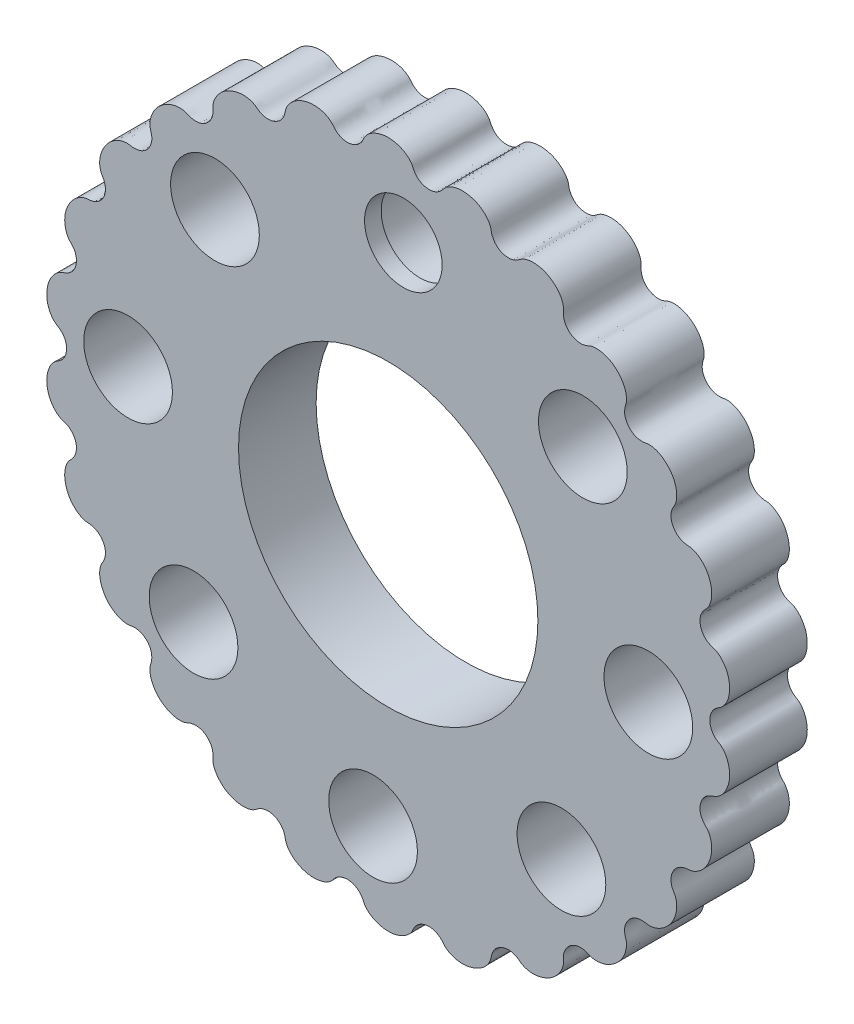
from build123d import *

# Parameters (mm, degrees)
SKETCH1_R        = 4
SKETCH1_R_2      = 13.5
EXTRUSION1_DEPTH = 7
EXTRUSION2_START = -1.5
SKETCH2_R        = 4
SKETCH2_R_2      = 3.5
EXTRUSION2_DEPTH = 1.5


with BuildPart() as part:
    # Sketch1 → Extrusion1 (new body)
    with BuildSketch(Plane.XY):
        with BuildLine():
            add(Edge.make_bspline(
                [(29, 0), (29, -0.376789204), (29.153513259, -0.703229563), (29.280402525, -0.883905996), (29.495133495, -1.189659407), (29.623510818, -1.242583836), (29.700019426, -1.295833756), (29.854226598, -1.403161804), (29.88265414, -1.412994243), (29.934648255, -1.448461782), (30.057359745, -1.532168844), (30.226573766, -1.667269836), (30.408052145, -1.955494437), (30.663331992, -2.360930792), (30.861446732, -3.06680081), (30.770659289, -3.762971134), (30.689739184, -4.383477382), (30.390255046, -4.954513185), (30.079404167, -5.289719413), (29.850529622, -5.536526414), (29.636586178, -5.660425735), (29.495438805, -5.723227119), (29.422146843, -5.755837266), (29.378667255, -5.76961159), (29.272559274, -5.805016474), (29.218748124, -5.822971556), (29.153849, -5.834396348), (28.970346246, -5.927674104), (28.848691254, -5.989513529), (28.638295722, -6.083579397), (28.402421601, -6.410574806), (28.230156467, -6.649388237), (28.101415723, -7.043920043), (28.114039967, -7.36632783), (28.13003751, -7.774885561), (28.272102362, -8.005844612), (28.356127129, -8.139006604), (28.505739094, -8.37611083), (28.568168114, -8.412323093), (28.612595809, -8.458659561), (28.711235488, -8.561537154), (28.744398474, -8.593760135), (28.808819097, -8.681895487), (28.948574282, -8.873097803), (29.151409878, -9.278419137), (29.175326567, -9.843287507), (29.201561715, -10.46291363), (28.968447422, -11.222843927), (28.567285081, -11.744523122), (28.224165345, -12.1907226), (27.796219964, -12.449058071), (27.512031378, -12.550259379), (27.358832379, -12.604814488), (27.25436537, -12.621049722), (27.158265381, -12.631046232), (27.099367254, -12.637172931), (27.067709293, -12.631488341), (26.873148531, -12.658460721), (26.788179826, -12.670240117), (26.665632167, -12.675675152), (26.416933975, -12.786433586), (26.232928362, -12.868380998), (25.946653249, -13.043759284), (25.740420799, -13.36934038), (25.544926925, -13.677968382), (25.489822974, -14.056912498), (25.506535744, -14.297475966), (25.533815346, -14.690138321), (25.631337693, -14.820256217), (25.67726007, -14.913047886), (25.767155033, -15.094691436), (25.790803082, -15.117574356), (25.819020041, -15.168683178), (25.885780874, -15.289605762), (25.95872212, -15.440829308), (26.000279455, -15.72147703), (26.063492675, -16.148372702), (25.978321637, -16.838256473), (25.624035928, -17.435865816), (25.273534038, -18.02709261), (24.684736969, -18.474969864), (24.204873828, -18.651888643), (23.850532913, -18.782529145), (23.58391245, -18.786530914), (23.423692808, -18.772306679), (23.353178507, -18.766046447), (23.313475257, -18.757998242), (23.193003065, -18.739109801), (23.130493718, -18.729309164), (23.057050179, -18.70439141), (22.817016308, -18.712748042), (22.665973243, -18.718006514), (22.411735467, -18.728224886), (22.074129263, -18.927651904), (21.803689676, -19.087402998), (21.537010762, -19.406590813), (21.426735852, -19.688830845), (21.270305731, -20.08920154), (21.316386948, -20.33233582), (21.33515342, -20.472892432), (21.369718287, -20.731775427), (21.400821881, -20.775045), (21.417284821, -20.831424873), (21.455421255, -20.96202896), (21.476017723, -21.033714564), (21.487059708, -21.194003219), (21.507665593, -21.493124234), (21.431991893, -22.035100014), (21.10046464, -22.56382238), (20.752479983, -23.118791147), (20.128266089, -23.598189384), (19.544493143, -23.790530755), (19.083278307, -23.942491709), (18.676784908, -23.930558237), (18.43738774, -23.882676974), (18.318275954, -23.858853706), (18.241679923, -23.831464215), (18.164838876, -23.800204857), (18.115287483, -23.78004708), (18.082088593, -23.759876823), (17.930173703, -23.703609039), (17.850190596, -23.673984081), (17.742072817, -23.617835381), (17.451890523, -23.598582777), (17.253236248, -23.585402744), (16.923751511, -23.605534598), (16.591139818, -23.793192282), (16.282780206, -23.967167077), (16.05488253, -24.265673436), (15.953178452, -24.485269327), (15.786354747, -24.84546924), (15.809506746, -25.014628377), (15.806088543, -25.121749654), (15.799481943, -25.328790473), (15.81061611, -25.361861802), (15.812109447, -25.418971328), (15.815641201, -25.554035759), (15.812406055, -25.704405001), (15.732664746, -25.953731572), (15.607596852, -26.344780447), (15.243418072, -26.912408891), (14.671037963, -27.292431394), (14.124718948, -27.655151056), (13.42767167, -27.814510539), (12.907715387, -27.778307624), (12.495865692, -27.74963183), (12.212478405, -27.625271416), (12.057583055, -27.532907426), (11.988100522, -27.49147504), (11.948201973, -27.461630149), (11.870914875, -27.403273336), (11.823322443, -27.367337937), (11.788753906, -27.319248435), (11.557639229, -27.198239248), (11.43929978, -27.13627797), (11.250146468, -27.031373812), (10.886678744, -27.017194857), (10.598987922, -27.005971975), (10.201432566, -27.111664102), (9.935629849, -27.301878904), (9.626564783, -27.523053281), (9.501689158, -27.761846503), (9.432870859, -27.908688978), (9.30095485, -28.190167505), (9.309619898, -28.270298288), (9.295631034, -28.337455332), (9.264435305, -28.487218252), (9.258552966, -28.527575136), (9.224995758, -28.627127141), (9.152563358, -28.842007673), (8.951268439, -29.22455999), (8.521291306, -29.564825082), (8.051312694, -29.936745595), (7.321670629, -30.195315854), (6.666548374, -30.18551273), (6.149536286, -30.17777626), (5.701998643, -30.01979544), (5.427983165, -29.85547943), (5.231722981, -29.737790128), (5.125408156, -29.631831284), (5.048933185, -29.544996261), (5.010375025, -29.501214633), (4.989516803, -29.470409418), (4.8984967, -29.364093053), (4.848368887, -29.305541078), (4.796999006, -29.214894746), (4.548899507, -29.046357174), (4.399181678, -28.944651691), (4.136411234, -28.798161464), (3.755673, -28.779285334), (3.414405592, -28.762366078), (3.042716869, -28.891985111), (2.824551091, -29.038709227), (2.484387171, -29.26748136), (2.405597414, -29.447359704), (2.344575844, -29.549095179), (2.22972714, -29.740571529), (2.224096245, -29.781013939), (2.199893849, -29.831433208), (2.143040371, -29.949872339), (2.090804872, -30.050667939), (1.948163151, -30.209644586), (1.704155366, -30.48159545), (1.181104411, -30.83769535), (0.518371049, -30.95472865), (-0.143255115, -31.071566429), (-0.891215069, -30.925579479), (-1.383857125, -30.651354116), (-1.724356119, -30.461818004), (-1.942342037, -30.234234972), (-2.058694069, -30.072741656), (-2.132811533, -29.969868721), (-2.164149671, -29.907017862), (-2.210380122, -29.809426793), (-2.229700089, -29.768642932), (-2.247192336, -29.723553138), (-2.308596707, -29.611786605), (-2.353963805, -29.529210671), (-2.403608644, -29.398358825), (-2.648504122, -29.176526635), (-2.811364542, -29.029003764), (-3.114843055, -28.83641096), (-3.489126798, -28.789352791), (-3.851241679, -28.743824595), (-4.188506196, -28.847742856), (-4.384723272, -28.948769214), (-4.717099561, -29.119899915), (-4.791674777, -29.244772824), (-4.856233022, -29.316051809), (-4.983929976, -29.457042464), (-4.997746831, -29.485760536), (-5.036905099, -29.53118873), (-5.133461533, -29.643205544), (-5.275985883, -29.78775877), (-5.572511333, -29.934209596), (-5.981254164, -30.136083415), (-6.669097215, -30.263104747), (-7.337150557, -30.118112097), (-8.005422406, -29.973072023), (-8.599322793, -29.565327432), (-8.90670342, -29.186424709), (-9.108385875, -28.937814273), (-9.197225057, -28.722791811), (-9.23961282, -28.581181709), (-9.25829201, -28.518777803), (-9.268174338, -28.472926288), (-9.283174683, -28.39863402), (-9.292241027, -28.3537311), (-9.298811144, -28.302862183), (-9.334414747, -28.175648604), (-9.36147998, -28.078943076), (-9.383274666, -27.927568033), (-9.586375382, -27.648595316), (-9.724085585, -27.459440937), (-10.002669302, -27.203566404), (-10.358057207, -27.08939079), (-10.712288342, -26.975586811), (-11.047428124, -27.018036104), (-11.247271358, -27.074370779), (-11.607160156, -27.175821391), (-11.690494591, -27.273289118), (-11.763091617, -27.324129438), (-11.91443087, -27.430113614), (-11.9326436, -27.451277308), (-11.990494242, -27.490297087), (-12.126510685, -27.582039053), (-12.364031199, -27.711242846), (-12.762304293, -27.763719538), (-13.262518248, -27.829628016), (-13.979986828, -27.712548347), (-14.561666645, -27.361677552), (-15.142387956, -27.01138493), (-15.544189918, -26.459983693), (-15.698654591, -26.05121109), (-15.795993367, -25.793615459), (-15.811648643, -25.609789997), (-15.812728579, -25.480621977), (-15.813143796, -25.430958983), (-15.811194859, -25.390583128), (-15.808098369, -25.314809119), (-15.80603082, -25.264214284), (-15.798697321, -25.203924251), (-15.809876958, -25.048307991), (-15.818162357, -24.932978399), (-15.817266226, -24.750262954), (-15.978009681, -24.434133715), (-16.092933598, -24.208116362), (-16.34396621, -23.916340633), (-16.652752822, -23.760262264), (-17.009927335, -23.57972589), (-17.333182061, -23.58392321), (-17.521203248, -23.604713619), (-17.853387005, -23.641444778), (-17.932654993, -23.703306136), (-18.00367317, -23.732275098), (-18.156071724, -23.794439858), (-18.183843461, -23.810305706), (-18.262019218, -23.836355439), (-18.440426314, -23.895804269), (-18.775676263, -23.962903754), (-19.236779227, -23.871624394), (-19.773156003, -23.765443924), (-20.426775322, -23.406126011), (-20.85810381, -22.895418828), (-21.286151212, -22.388596558), (-21.47085206, -21.779570597), (-21.488930141, -21.394614583), (-21.500621317, -21.145661823), (-21.468865946, -21.013759747), (-21.431565807, -20.881029713), (-21.419598524, -20.838444941), (-21.405336227, -20.798008705), (-21.378065716, -20.691137708), (-21.358368957, -20.613947657), (-21.314606088, -20.512619306), (-21.320946107, -20.221114476), (-21.325157041, -20.027501856), (-21.367726323, -19.699302641), (-21.596507682, -19.37075596), (-21.805015671, -19.071323315), (-22.144668616, -18.865630978), (-22.383630568, -18.788290041), (-22.775331784, -18.661514466), (-22.938900049, -18.709912643), (-23.044907923, -18.72000009), (-23.244105229, -18.738955212), (-23.275722221, -18.753159272), (-23.332294806, -18.761415327), (-23.470632783, -18.781604011), (-23.633917403, -18.796910673), (-23.910368317, -18.73778214), (-24.317955011, -18.650605712), (-24.911212213, -18.348260848), (-25.344006425, -17.831383438), (-25.776274137, -17.315134817), (-26.009005348, -16.620732001), (-26.022312378, -16.099736428), (-26.030488039, -15.779643688), (-25.971521912, -15.531144499), (-25.912768729, -15.372231853), (-25.879445986, -15.282102182), (-25.848804962, -15.221918981), (-25.813525479, -15.158792832), (-25.79076123, -15.118060394), (-25.767720937, -15.0833216), (-25.712862173, -14.981763959), (-25.678735759, -14.918587213), (-25.623775022, -14.838440372), (-25.560344984, -14.609836108), (-25.515341819, -14.447642989), (-25.45606319, -14.173517302), (-25.552037739, -13.803688322), (-25.638692263, -13.469773193), (-25.891757905, -13.130612652), (-26.118413124, -12.961295021), (-26.446587443, -12.716139852), (-26.652479534, -12.698358105), (-26.773903808, -12.674868854), (-26.998785053, -12.631366088), (-27.042788745, -12.641056046), (-27.098481374, -12.636501344), (-27.234209956, -12.625401073), (-27.335712061, -12.614944718), (-27.526823798, -12.544915294), (-27.851146092, -12.426073282), (-28.353695378, -12.095384857), (-28.706603378, -11.546591504), (-29.06035764, -10.99648216), (-29.221901536, -10.261461854), (-29.164411473, -9.690095777), (-29.116641163, -9.215329648), (-28.946347537, -8.875733747), (-28.821278154, -8.699208681), (-28.761199142, -8.614412136), (-28.719790087, -8.569916158), (-28.650828294, -8.498340774), (-28.617066481, -8.463299418), (-28.577830967, -8.430353535), (-28.479946744, -8.310527477), (-28.415974196, -8.232214772), (-28.307335635, -8.12424224), (-28.199217347, -7.814438004), (-28.123005002, -7.596057676), (-28.071043132, -7.229002615), (-28.174726822, -6.87560927), (-28.282711502, -6.50755652), (-28.517068857, -6.249167235), (-28.680068264, -6.116174749), (-28.96041353, -5.887438862), (-29.085822206, -5.872195266), (-29.168080895, -5.841573506), (-29.337012176, -5.778686858), (-29.366231414, -5.775040483), (-29.428891311, -5.75083548), (-29.575851639, -5.694065916), (-29.800298383, -5.583648839), (-30.060367543, -5.309997757), (-30.393485756, -4.959482689), (-30.716850495, -4.333209538), (-30.781775017, -3.665272415), (-30.845824216, -3.00634053), (-30.65602066, -2.355101486), (-30.415698666, -1.967728855), (-30.277120915, -1.744356755), (-30.13509608, -1.604275471), (-30.03007677, -1.519291986), (-29.957369662, -1.460456107), (-29.916605658, -1.435631903), (-29.813666622, -1.37061783), (-29.766710644, -1.340961449), (-29.708025916, -1.314263856), (-29.557868822, -1.186841016), (-29.455260582, -1.099767985), (-29.272385362, -0.963203143), (-29.116117525, -0.584778374), (-29.000884912, -0.305726228), (-28.969803973, 0.125948685), (-29.065388195, 0.442485153), (-29.184052374, 0.835453149), (-29.377333441, 1.019376249), (-29.489749135, 1.125797953), (-29.690366917, 1.315718822), (-29.757206414, 1.334920749), (-29.810603818, 1.368682388), (-29.929768192, 1.444026587), (-29.971689203, 1.468878417), (-30.058370404, 1.542800073), (-30.243927978, 1.701043417), (-30.54151476, 2.059991498), (-30.694284834, 2.614224595), (-30.861323307, 3.220221883), (-30.801284883, 4.017880871), (-30.526869714, 4.613201454), (-30.289365399, 5.128447049), (-29.928196364, 5.469300484), (-29.68153631, 5.623716451), (-29.575145044, 5.690320305), (-29.492430437, 5.726810499), (-29.419145192, 5.754562991), (-29.361545051, 5.776375669), (-29.327692281, 5.783104484), (-29.180206176, 5.837097496), (-29.109781404, 5.862879217), (-29.010074318, 5.88508112), (-28.793211902, 6.031980364), (-28.6485518, 6.129970877), (-28.42112486, 6.310060413), (-28.259066262, 6.65362343), (-28.115026168, 6.958987354), (-28.09008166, 7.358682651), (-28.14604737, 7.623810648), (-28.233016296, 8.035811085), (-28.378672015, 8.181444066), (-28.45394424, 8.277958096), (-28.596223142, 8.460388073), (-28.632573095, 8.479048758), (-28.671514566, 8.519909872), (-28.762970552, 8.615874231), (-28.838162873, 8.699534929), (-28.936455769, 8.889221435), (-29.106812244, 9.217976878), (-29.255848082, 9.847598949), (-29.121664872, 10.519348259), (-28.987564861, 11.190681059), (-28.56740915, 11.841350341), (-28.129487583, 12.195502904), (-27.780573832, 12.47767375), (-27.461018124, 12.580313829), (-27.27527929, 12.614447663), (-27.199624067, 12.628351071), (-27.150829028, 12.632435802), (-27.058014802, 12.639711166), (-27.00151509, 12.644139969), (-26.943305829, 12.636091875), (-26.723316859, 12.685427116), (-26.6026533, 12.712487408), (-26.409624397, 12.747329453), (-26.128422509, 12.953880477), (-25.910944679, 13.113624314), (-25.662798484, 13.427513535), (-25.566322816, 13.752334315), (-25.452954535, 14.134030287), (-25.511376242, 14.428267343), (-25.557174596, 14.598242149), (-25.63761469, 14.896785406), (-25.701254959, 14.96199933), (-25.736666763, 15.024871352), (-25.812643968, 15.159765371), (-25.832711467, 15.188601008), (-25.86858561, 15.265908818), (-25.95180307, 15.4452402), (-26.061021603, 15.796670594), (-26.009969417, 16.290275064), (-25.951468756, 16.855896049), (-25.638772006, 17.555314201), (-25.162283149, 18.029466008), (-24.748728938, 18.440991847), (-24.24642911, 18.669333848), (-23.89197135, 18.741625677), (-23.653710104, 18.790219172), (-23.49403235, 18.781678219), (-23.375015124, 18.767162962), (-23.315572934, 18.759913435), (-23.280311537, 18.750630578), (-23.137565616, 18.73089565), (-23.061042331, 18.720316143), (-22.962061884, 18.686556057), (-22.664548487, 18.725245809), (-22.484723827, 18.748630879), (-22.190520146, 18.8138919), (-21.893470913, 19.052646676), (-21.626951442, 19.266863007), (-21.435540536, 19.610440168), (-21.36995716, 19.864601166), (-21.267593511, 20.261299971), (-21.327982031, 20.447618467), (-21.349786939, 20.563994202), (-21.390832203, 20.783058317), (-21.413355093, 20.816991437), (-21.428664725, 20.870774772), (-21.464631811, 20.997128553), (-21.492452324, 21.107715369), (-21.490910217, 21.321951179), (-21.488278104, 21.687615204), (-21.332419784, 22.300574747), (-20.914098226, 22.82707231), (-20.496872099, 23.352191169), (-19.841777334, 23.738304129), (-19.291903219, 23.860064829), (-18.924188821, 23.941489216), (-18.617245176, 23.920560063), (-18.422408764, 23.879604969), (-18.31563017, 23.857159846), (-18.243553296, 23.831836435), (-18.173556833, 23.803728826), (-18.130392891, 23.786396018), (-18.093787939, 23.768849924), (-17.999094408, 23.73041191), (-17.92817914, 23.701625972), (-17.846767922, 23.641691775), (-17.525942455, 23.605244833), (-17.345331763, 23.584726801), (-17.042466604, 23.57739302), (-16.695375411, 23.739540695), (-16.385650533, 23.884232262), (-16.118572277, 24.171891566), (-15.994502316, 24.402601032), (-15.801287793, 24.761885575), (-15.814885759, 24.956858471), (-15.808159699, 25.074992256), (-15.795544122, 25.296567105), (-15.809226093, 25.335448685), (-15.811235377, 25.391185584), (-15.81594861, 25.521929151), (-15.81661578, 25.633771899), (-15.76557369, 25.838231515), (-15.678418206, 26.187350782), (-15.38935816, 26.738476294), (-14.866909812, 27.150554528), (-14.345665583, 27.56168302), (-13.625065441, 27.789169095), (-13.059243608, 27.784206894), (-12.699360044, 27.781050751), (-12.40959978, 27.699749511), (-12.22295316, 27.617771279), (-12.088985747, 27.558930611), (-12.012415962, 27.507785565), (-11.935379801, 27.451475288), (-11.89957228, 27.425301457), (-11.867671351, 27.398850043), (-11.78411078, 27.339017082), (-11.72485787, 27.296589452), (-11.65447184, 27.228848894), (-11.411755341, 27.130671047), (-11.251421739, 27.06581675), (-10.97525545, 26.974485588), (-10.591009136, 27.034225453), (-10.245095457, 27.088005634), (-9.886721339, 27.30723371), (-9.699148999, 27.510999828), (-9.422955251, 27.81103835), (-9.386355398, 28.006730408), (-9.350491864, 28.121355102), (-9.283595069, 28.335166289), (-9.287629251, 28.377653166), (-9.276328264, 28.432202636), (-9.248619946, 28.565949724), (-9.222912155, 28.675415127), (-9.119915077, 28.867977144), (-8.949932482, 29.185774426), (-8.538283511, 29.646741189), (-7.937079008, 29.919616823), (-7.336306535, 30.192296368), (-6.58767896, 30.242266848), (-6.040570614, 30.10466661), (-5.614070166, 29.997399807), (-5.322579412, 29.803931331), (-5.168650159, 29.66592866), (-5.09200491, 29.597213657), (-5.050374214, 29.548840834), (-4.992991306, 29.478663173), (-4.962876994, 29.441834229), (-4.936434411, 29.401984589), (-4.837846061, 29.296019422), (-4.775916492, 29.229456008), (-4.695712644, 29.124026378), (-4.441848526, 28.979698039), (-4.260308077, 28.876487582), (-3.941762372, 28.754072863), (-3.56794143, 28.78151104), (-3.197466652, 28.808703611), (-2.868927436, 28.989558501), (-2.690954424, 29.139445162), (-2.393105298, 29.390289998), (-2.349772761, 29.535692131), (-2.302761238, 29.622483952), (-2.20886408, 29.795835184), (-2.203550235, 29.82579248), (-2.175867732, 29.88018106), (-2.11046229, 30.008684946), (-2.009773476, 30.177613031), (-1.768150686, 30.385191874), (-1.415577805, 30.688088264), (-0.752418447, 30.988774256), (-0.046167636, 30.999644728), (0.592266715, 31.009471383), (1.219510345, 30.785204282), (1.605011517, 30.51235251), (1.891097503, 30.309865272), (2.045930615, 30.104725908), (2.127116658, 29.968736277), (2.167438181, 29.901196229), (2.186602044, 29.859458673), (2.233005038, 29.76152411), (2.257355256, 29.710132427), (2.275725221, 29.64749951), (2.392614611, 29.47339957), (2.467027217, 29.362566327), (2.581908309, 29.173501841), (2.917495722, 28.980878823), (3.168004516, 28.837089878), (3.570530407, 28.746735558), (3.894196472, 28.792482835), (4.296685945, 28.849371089), (4.518598116, 29.016680122), (4.645208022, 29.117156834), (4.869888815, 29.295461895), (4.900400795, 29.365411925), (4.942187589, 29.416317379), (5.034218341, 29.528430961), (5.059850792, 29.562818103), (5.133890892, 29.633725391), (5.297447577, 29.790361604), (5.653420861, 30.036407331), (6.193533924, 30.138262765), (6.787121194, 30.250202456), (7.56080253, 30.136873657), (8.138149347, 29.818829343), (8.581443665, 29.574630824), (8.897838497, 29.23499257), (9.063487098, 28.966067258), (9.18165652, 28.774222905), (9.228771833, 28.629915123), (9.256579828, 28.51949661), (9.272107014, 28.457842082), (9.275055696, 28.42350385), (9.309657797, 28.273192334), (9.327096963, 28.197436599), (9.331152725, 28.091834709), (9.473647564, 27.82769558), (9.560207198, 27.667242144), (9.727681559, 27.414950204), (10.056909547, 27.223458982), (10.353094853, 27.051186612), (10.741565015, 26.996366299), (11.001162027, 27.025939364), (11.407533903, 27.072232894), (11.558749341, 27.1944073), (11.659183654, 27.255867397), (11.848352182, 27.371627795), (11.871971738, 27.404431533), (11.916832906, 27.437793645), (12.022261653, 27.516198328), (12.117104247, 27.582173773), (12.319996567, 27.656847025), (12.664297564, 27.783564857), (13.292839116, 27.853335393), (13.932250402, 27.648073894), (14.568901864, 27.443698344), (15.159421893, 26.969881), (15.467654163, 26.500496006), (15.659825574, 26.207851836), (15.751543918, 25.931415117), (15.787604242, 25.737120609), (15.813498746, 25.597599956), (15.814641251, 25.508390037), (15.811972558, 25.413941053), (15.810730864, 25.369995665), (15.807069113, 25.328551417), (15.805393111, 25.226148408), (15.804179271, 25.151983315), (15.7873494, 25.05356127), (15.848551533, 24.790228208), (15.888635603, 24.617759368), (15.977450228, 24.332208035), (16.252246132, 24.052811244), (16.500029195, 23.800879567), (16.883970695, 23.641332385), (17.153354448, 23.60733672), (17.555385218, 23.55660128), (17.730538136, 23.637926529), (17.842431172, 23.673409624), (18.05215936, 23.739917832), (18.083766447, 23.766279926), (18.135066232, 23.787868373), (18.260697305, 23.840737595), (18.372012121, 23.883670807), (18.597896167, 23.906652225), (18.963986255, 23.94389819), (19.58182752, 23.857177181), (20.144851752, 23.50995364), (20.726503476, 23.15124231), (21.191774557, 22.530343728), (21.37240243, 21.993317545), (21.51231617, 21.577338879), (21.502051841, 21.242345513), (21.470701674, 21.052896276), (21.455936181, 20.963668318), (21.441653252, 20.91493797), (21.411311027, 20.810976441), (21.396040953, 20.758656602), (21.370577153, 20.704114298), (21.340293152, 20.508535286), (21.321717047, 20.388567782), (21.28105173, 20.199338227), (21.37268296, 19.854187676), (21.443156605, 19.58873214), (21.654701782, 19.230742735), (21.933743468, 19.021367021), (22.254107694, 18.780985416), (22.548706875, 18.734993043), (22.722364767, 18.718793861), (23.027794823, 18.690302688), (23.109111501, 18.726245696), (23.179524642, 18.737021226), (23.331364546, 18.760257733), (23.366301479, 18.768774906), (23.453813913, 18.774656509), (23.655700667, 18.788225069), (24.034486714, 18.761478442), (24.484384746, 18.528096714), (24.987179246, 18.267275281), (25.516427984, 17.72992395), (25.784568682, 17.124692357), (26.034421704, 16.560738643), (26.054389766, 15.98118336), (25.983955408, 15.627199703), (25.93824624, 15.397478032), (25.876945456, 15.272978571), (25.816485337, 15.164105626), (25.795349021, 15.12604462), (25.773814482, 15.091757373), (25.728534405, 15.01034342), (25.695222559, 14.950448444), (25.640906458, 14.879361146), (25.569802117, 14.642575819), (25.523697247, 14.4890415), (25.457187963, 14.231317448), (25.538420004, 13.860612761), (25.610866156, 13.530002724), (25.852159498, 13.171636715), (26.083072201, 12.988500473), (26.407274822, 12.731376248), (26.624500014, 12.705657793), (26.751105714, 12.679434353), (26.983700433, 12.631257741), (27.030982702, 12.64190545), (27.087317817, 12.637403241), (27.217776505, 12.6269772), (27.302684737, 12.618898166), (27.467056974, 12.565565056), (27.768649791, 12.467708611), (28.260881462, 12.178795965), (28.630768295, 11.658690446), (29.001460154, 11.137452963), (29.203853989, 10.413047322), (29.174387587, 9.822933994), (29.150775545, 9.350063893), (29.000317503, 8.982726488), (28.872952639, 8.77720065), (28.80852858, 8.673240983), (28.755018636, 8.609811649), (28.699503989, 8.54969935), (28.669134773, 8.516814995), (28.640063318, 8.48874736), (28.575255084, 8.419221478), (28.527612321, 8.36811061), (28.45538984, 8.313194125), (28.323398012, 8.084843835), (28.24092458, 7.94216203), (28.114652627, 7.697481464), (28.112882147, 7.313407763), (28.111301224, 6.9704548), (28.269825348, 6.57261128), (28.4502273, 6.347759547), (28.707970046, 6.026510785), (28.907371612, 5.956119728), (29.021366479, 5.902786247), (29.23175097, 5.804356048), (29.278019071, 5.803312496), (29.331212991, 5.785537568), (29.460376133, 5.742377268), (29.552018589, 5.709870289), (29.716067657, 5.601503494), (29.996607113, 5.416186004), (30.402321802, 4.990358438), (30.620458512, 4.384591576), (30.843511302, 3.765172736), (30.834342658, 3.000421818), (30.642754999, 2.448412257), (30.486542596, 1.998327215), (30.241623115, 1.704057531), (30.076359327, 1.55839712), (29.993727432, 1.485566915), (29.940583244, 1.450626754), (29.855027721, 1.396665019), (29.81224996, 1.369684152), (29.765950817, 1.348657309), (29.629385223, 1.244386394), (29.550532024, 1.184180197), (29.426925187, 1.103473897), (29.260661084, 0.855118407), (29.138972937, 0.673347843), (29, 0.357362991), (29, 0)],
                knots=[0, 0, 0, 0, 0.27327128, 0.27327128, 0.27327128, 0.735720224, 0.735720224, 0.735720224, 1.667810689, 1.667810689, 1.667810689, 3.867640605, 3.867640605, 3.867640605, 6.962071187, 6.962071187, 6.962071187, 9.720180006, 9.720180006, 9.720180006, 11.750931547, 11.750931547, 11.750931547, 12.805416376, 12.805416376, 12.805416376, 13.340183332, 13.340183332, 13.340183332, 13.694712449, 13.694712449, 13.694712449, 13.953634478, 13.953634478, 13.953634478, 14.281742547, 14.281742547, 14.281742547, 14.865961877, 14.865961877, 14.865961877, 16.163062891, 16.163062891, 16.163062891, 18.977015681, 18.977015681, 18.977015681, 22.063750132, 22.063750132, 22.063750132, 24.703877084, 24.703877084, 24.703877084, 26.12710387, 26.12710387, 26.12710387, 26.999376521, 26.999376521, 26.999376521, 27.380316011, 27.380316011, 27.380316011, 27.662163673, 27.662163673, 27.662163673, 27.929335455, 27.929335455, 27.929335455, 28.365429521, 28.365429521, 28.365429521, 29.219101794, 29.219101794, 29.219101794, 31.238875534, 31.238875534, 31.238875534, 34.311170798, 34.311170798, 34.311170798, 37.35065353, 37.35065353, 37.35065353, 39.595070736, 39.595070736, 39.595070736, 40.582861675, 40.582861675, 40.582861675, 41.095396274, 41.095396274, 41.095396274, 41.417912412, 41.417912412, 41.417912412, 41.676264095, 41.676264095, 41.676264095, 42.04274805, 42.04274805, 42.04274805, 42.717753387, 42.717753387, 42.717753387, 44.281404563, 44.281404563, 44.281404563, 47.199396046, 47.199396046, 47.199396046, 50.262240061, 50.262240061, 50.262240061, 52.68206631, 52.68206631, 52.68206631, 53.886048084, 53.886048084, 53.886048084, 54.662442685, 54.662442685, 54.662442685, 55.071214023, 55.071214023, 55.071214023, 55.351052508, 55.351052508, 55.351052508, 55.610486823, 55.610486823, 55.610486823, 56.036033118, 56.036033118, 56.036033118, 56.858516347, 56.858516347, 56.858516347, 58.803694964, 58.803694964, 58.803694964, 61.85455274, 61.85455274, 61.85455274, 64.766501617, 64.766501617, 64.766501617, 67.073013323, 67.073013323, 67.073013323, 68.10766204, 68.10766204, 68.10766204, 68.74478582, 68.74478582, 68.74478582, 69.071017274, 69.071017274, 69.071017274, 69.329234961, 69.329234961, 69.329234961, 69.629480451, 69.629480451, 69.629480451, 70.205013232, 70.205013232, 70.205013232, 71.488474566, 71.488474566, 71.488474566, 74.258794008, 74.258794008, 74.258794008, 77.286840815, 77.286840815, 77.286840815, 79.676527305, 79.676527305, 79.676527305, 81.388110577, 81.388110577, 81.388110577, 82.251079216, 82.251079216, 82.251079216, 82.726344882, 82.726344882, 82.726344882, 83.013148135, 83.013148135, 83.013148135, 83.270218726, 83.270218726, 83.270218726, 83.671043002, 83.671043002, 83.671043002, 84.425434422, 84.425434422, 84.425434422, 86.19756373, 86.19756373, 86.19756373, 89.229028452, 89.229028452, 89.229028452, 92.255428643, 92.255428643, 92.255428643, 94.347183107, 94.347183107, 94.347183107, 95.679652626, 95.679652626, 95.679652626, 96.236499184, 96.236499184, 96.236499184, 96.64791147, 96.64791147, 96.64791147, 96.921508918, 96.921508918, 96.921508918, 97.186211056, 97.186211056, 97.186211056, 97.634595652, 97.634595652, 97.634595652, 98.521505556, 98.521505556, 98.521505556, 100.708447476, 100.708447476, 100.708447476, 103.723017825, 103.723017825, 103.723017825, 106.738574179, 106.738574179, 106.738574179, 108.717179068, 108.717179068, 108.717179068, 109.589099009, 109.589099009, 109.589099009, 110.116095319, 110.116095319, 110.116095319, 110.516708658, 110.516708658, 110.516708658, 110.788340121, 110.788340121, 110.788340121, 111.059087437, 111.059087437, 111.059087437, 111.546664248, 111.546664248, 111.546664248, 112.563090307, 112.563090307, 112.563090307, 114.952876385, 114.952876385, 114.952876385, 117.954345382, 117.954345382, 117.954345382, 120.950868485, 120.950868485, 120.950868485, 122.839183047, 122.839183047, 122.839183047, 123.565209152, 123.565209152, 123.565209152, 124.049981858, 124.049981858, 124.049981858, 124.409254331, 124.409254331, 124.409254331, 124.666117043, 124.666117043, 124.666117043, 124.963231006, 124.963231006, 124.963231006, 125.488152872, 125.488152872, 125.488152872, 126.614587499, 126.614587499, 126.614587499, 129.185255662, 129.185255662, 129.185255662, 132.175578446, 132.175578446, 132.175578446, 135.143154053, 135.143154053, 135.143154053, 137.062298345, 137.062298345, 137.062298345, 137.678031794, 137.678031794, 137.678031794, 138.122759535, 138.122759535, 138.122759535, 138.418140242, 138.418140242, 138.418140242, 138.687345904, 138.687345904, 138.687345904, 139.12862195, 139.12862195, 139.12862195, 139.957815067, 139.957815067, 139.957815067, 141.985456179, 141.985456179, 141.985456179, 144.97491831, 144.97491831, 144.97491831, 147.960743717, 147.960743717, 147.960743717, 149.795195074, 149.795195074, 149.795195074, 150.835631452, 150.835631452, 150.835631452, 151.506977805, 151.506977805, 151.506977805, 151.924607413, 151.924607413, 151.924607413, 152.220912684, 152.220912684, 152.220912684, 152.488443942, 152.488443942, 152.488443942, 152.875802719, 152.875802719, 152.875802719, 153.593202304, 153.593202304, 153.593202304, 155.341577808, 155.341577808, 155.341577808, 158.308622964, 158.308622964, 158.308622964, 161.282783008, 161.282783008, 161.282783008, 163.754106576, 163.754106576, 163.754106576, 164.941245048, 164.941245048, 164.941245048, 165.522435667, 165.522435667, 165.522435667, 165.902274659, 165.902274659, 165.902274659, 166.170022335, 166.170022335, 166.170022335, 166.448876676, 166.448876676, 166.448876676, 166.928482682, 166.928482682, 166.928482682, 167.913429767, 167.913429767, 167.913429767, 170.223490153, 170.223490153, 170.223490153, 173.182407649, 173.182407649, 173.182407649, 176.10143253, 176.10143253, 176.10143253, 177.784640539, 177.784640539, 177.784640539, 178.949961331, 178.949961331, 178.949961331, 179.481526219, 179.481526219, 179.481526219, 179.844765382, 179.844765382, 179.844765382, 180.112619593, 180.112619593, 180.112619593, 180.445150417, 180.445150417, 180.445150417, 181.038587098, 181.038587098, 181.038587098, 182.362930697, 182.362930697, 182.362930697, 185.197939711, 185.197939711, 185.197939711, 188.297732526, 188.297732526, 188.297732526, 190.980580455, 190.980580455, 190.980580455, 192.137766567, 192.137766567, 192.137766567, 193.047282296, 193.047282296, 193.047282296, 193.481577022, 193.481577022, 193.481577022, 193.771277379, 193.771277379, 193.771277379, 194.02876737, 194.02876737, 194.02876737, 194.42889859, 194.42889859, 194.42889859, 195.185223125, 195.185223125, 195.185223125, 196.961488953, 196.961488953, 196.961488953, 200.040026649, 200.040026649, 200.040026649, 203.116655537, 203.116655537, 203.116655537, 205.567957794, 205.567957794, 205.567957794, 206.566423299, 206.566423299, 206.566423299, 207.17422897, 207.17422897, 207.17422897, 207.5076093, 207.5076093, 207.5076093, 207.76544125, 207.76544125, 207.76544125, 208.068418837, 208.068418837, 208.068418837, 208.600567795, 208.600567795, 208.600567795, 209.742311133, 209.742311133, 209.742311133, 212.390819859, 212.390819859, 212.390819859, 215.425743981, 215.425743981, 215.425743981, 218.059815336, 218.059815336, 218.059815336, 219.830399005, 219.830399005, 219.830399005, 220.714702676, 220.714702676, 220.714702676, 221.188760509, 221.188760509, 221.188760509, 221.475293113, 221.475293113, 221.475293113, 221.732376821, 221.732376821, 221.732376821, 222.133637444, 222.133637444, 222.133637444, 222.888965035, 222.888965035, 222.888965035, 224.663464485, 224.663464485, 224.663464485, 227.692232709, 227.692232709, 227.692232709, 230.713069703, 230.713069703, 230.713069703, 232.733177989, 232.733177989, 232.733177989, 233.840282767, 233.840282767, 233.840282767, 234.522988765, 234.522988765, 234.522988765, 235.034262116, 235.034262116, 235.034262116, 235.322086629, 235.322086629, 235.322086629, 235.578925218, 235.578925218, 235.578925218, 235.978900722, 235.978900722, 235.978900722, 236.729105356, 236.729105356, 236.729105356, 238.488880851, 238.488880851, 238.488880851, 241.493735993, 241.493735993, 241.493735993, 244.491665657, 244.491665657, 244.491665657, 246.398459547, 246.398459547, 246.398459547, 247.767079274, 247.767079274, 247.767079274, 248.403233513, 248.403233513, 248.403233513, 248.854331306, 248.854331306, 248.854331306, 249.152317367, 249.152317367, 249.152317367, 249.420576166, 249.420576166, 249.420576166, 249.815577919, 249.815577919, 249.815577919, 250.552380705, 250.552380705, 250.552380705, 252.358910223, 252.358910223, 252.358910223, 255.340340193, 255.340340193, 255.340340193, 258.319627693, 258.319627693, 258.319627693, 260.642142899, 260.642142899, 260.642142899, 261.798581669, 261.798581669, 261.798581669, 262.40547592, 262.40547592, 262.40547592, 262.78670453, 262.78670453, 262.78670453, 263.05932444, 263.05932444, 263.05932444, 263.32950406, 263.32950406, 263.32950406, 263.781666796, 263.781666796, 263.781666796, 264.684781469, 264.684781469, 264.684781469, 266.81857029, 266.81857029, 266.81857029, 269.932167619, 269.932167619, 269.932167619, 272.746787381, 272.746787381, 272.746787381, 274.835557339, 274.835557339, 274.835557339, 275.872957182, 275.872957182, 275.872957182, 276.417338274, 276.417338274, 276.417338274, 276.763895096, 276.763895096, 276.763895096, 277.022592317, 277.022592317, 277.022592317, 277.344290881, 277.344290881, 277.344290881, 277.915174236, 277.915174236, 277.915174236, 279.172481119, 279.172481119, 279.172481119, 281.949907732, 281.949907732, 281.949907732, 285.002315078, 285.002315078, 285.002315078, 287.345992732, 287.345992732, 287.345992732, 289.017911676, 289.017911676, 289.017911676, 289.951463217, 289.951463217, 289.951463217, 290.421965311, 290.421965311, 290.421965311, 290.707775589, 290.707775589, 290.707775589, 290.964900766, 290.964900766, 290.964900766, 291.367403242, 291.367403242, 291.367403242, 292.125518654, 292.125518654, 292.125518654, 293.907174371, 293.907174371, 293.907174371, 296.930580283, 296.930580283, 296.930580283, 299.940936591, 299.940936591, 299.940936591, 301.817782322, 301.817782322, 301.817782322, 303.165523673, 303.165523673, 303.165523673, 303.792603132, 303.792603132, 303.792603132, 304.246763674, 304.246763674, 304.246763674, 304.544214142, 304.544214142, 304.544214142, 304.812424791, 304.812424791, 304.812424791, 305.212704812, 305.212704812, 305.212704812, 305.962974945, 305.962974945, 305.962974945, 307.800355798, 307.800355798, 307.800355798, 310.778197432, 310.778197432, 310.778197432, 313.854560092, 313.854560092, 313.854560092, 316.237500207, 316.237500207, 316.237500207, 317.35983188, 317.35983188, 317.35983188, 317.924658238, 317.924658238, 317.924658238, 318.271120816, 318.271120816, 318.271120816, 318.537585432, 318.537585432, 318.537585432, 318.843510083, 318.843510083, 318.843510083, 319.381571337, 319.381571337, 319.381571337, 320.541854324, 320.541854324, 320.541854324, 323.218568433, 323.218568433, 323.218568433, 326.20999546, 326.20999546, 326.20999546, 328.997401803, 328.997401803, 328.997401803, 330.806320463, 330.806320463, 330.806320463, 331.438702217, 331.438702217, 331.438702217, 331.903935623, 331.903935623, 331.903935623, 332.205598293, 332.205598293, 332.205598293, 332.474633755, 332.474633755, 332.474633755, 332.852360928, 332.852360928, 332.852360928, 333.546305558, 333.546305558, 333.546305558, 335.153315761, 335.153315761, 335.153315761, 338.101883853, 338.101883853, 338.101883853, 341.05686924, 341.05686924, 341.05686924, 343.424760585, 343.424760585, 343.424760585, 344.62249416, 344.62249416, 344.62249416, 345.277712757, 345.277712757, 345.277712757, 345.759386494, 345.759386494, 345.759386494, 346.060354266, 346.060354266, 346.060354266, 346.329099011, 346.329099011, 346.329099011, 346.713058322, 346.713058322, 346.713058322, 347.42167869, 347.42167869, 347.42167869, 349.142319588, 349.142319588, 349.142319588, 352.084778602, 352.084778602, 352.084778602, 355.093550896, 355.093550896, 355.093550896, 357.546775448, 357.546775448, 357.546775448, 358.773387724, 358.773387724, 358.773387724, 359.386693862, 359.386693862, 359.386693862, 359.740817834, 359.740817834, 359.740817834, 360, 360, 360, 360], degree=3))
        make_face()
        with Locations((-17.555089174, -15.622702842)):
            Circle(SKETCH1_R, mode=Mode.SUBTRACT)
        with Locations((-1.366403479, -23.460241719)):
            Circle(SKETCH1_R, mode=Mode.SUBTRACT)
        with Locations((15.622702842, -17.555089174)):
            Circle(SKETCH1_R, mode=Mode.SUBTRACT)
        with Locations((23.460241719, -1.366403479)):
            Circle(SKETCH1_R, mode=Mode.SUBTRACT)
        with Locations((-23.460241719, 1.366403479)):
            Circle(SKETCH1_R, mode=Mode.SUBTRACT)
        Circle(SKETCH1_R_2, mode=Mode.SUBTRACT)
        with Locations((-15.622702842, 17.555089174)):
            Circle(SKETCH1_R, mode=Mode.SUBTRACT)
        with Locations((1.366403479, 23.460241719)):
            Circle(SKETCH1_R, mode=Mode.SUBTRACT)
        with Locations((17.555089174, 15.622702842)):
            Circle(SKETCH1_R, mode=Mode.SUBTRACT)
    extrude(amount=EXTRUSION1_DEPTH)

    # Sketch2 → Extrusion2 (add)
    with BuildSketch(Plane.XY.offset(7).offset(EXTRUSION2_START)):
        with Locations((1.366403479, 23.460241719)):
            Circle(SKETCH2_R)
        with Locations((1.366403479, 23.460241719)):
            Circle(SKETCH2_R_2, mode=Mode.SUBTRACT)
    extrude(amount=EXTRUSION2_DEPTH)


solid = part.part
